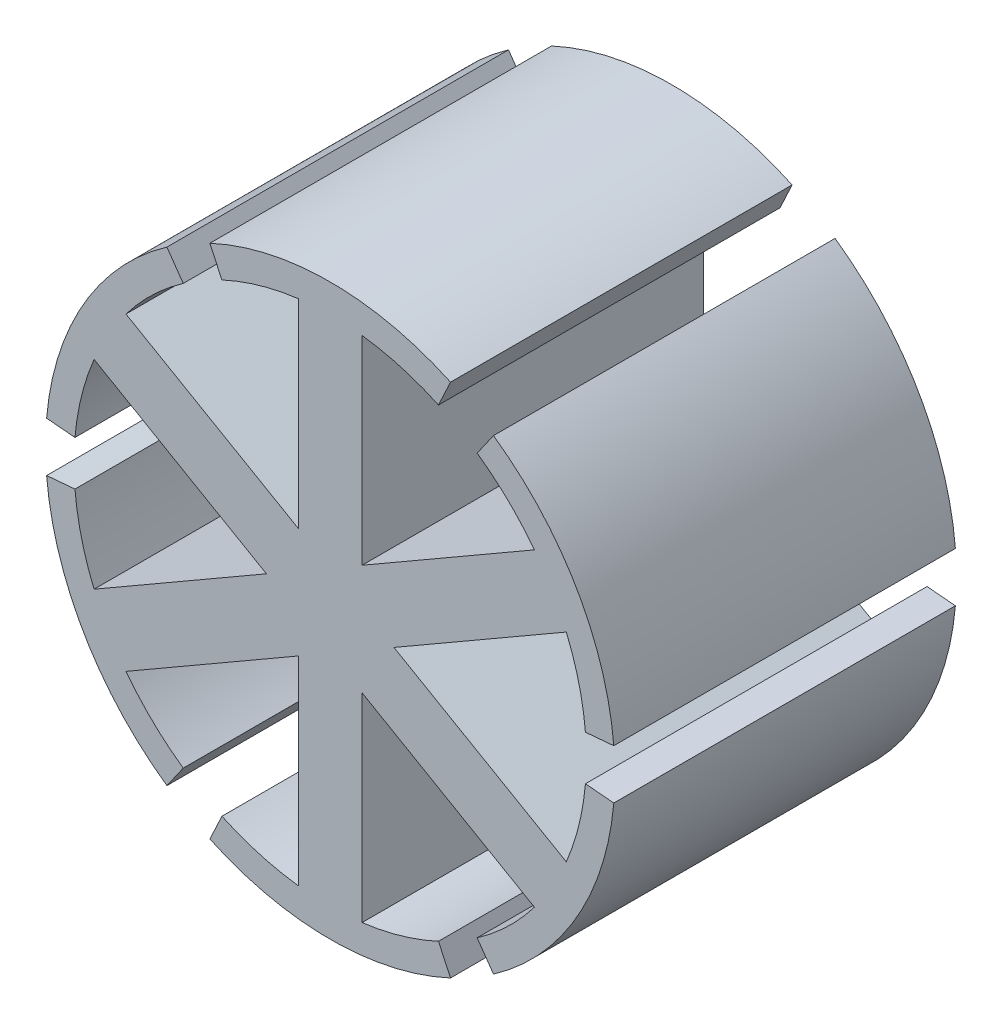
from build123d import *

# Parameters (mm, degrees)
BOSS_EXTRUDE1_DEPTH = 30


with BuildPart() as part:
    # Sketch2 → Boss-Extrude1 (new body)
    with BuildSketch(Plane.XY):
        with BuildLine():
            Line((2.8, 4.849742261), (17.934101996, 13.587420123))
            ThreePointArc((17.934101996, 13.587420123), (15.608801126, 16.205410436), (12.905469818, 18.430920997))
            Line((12.905469818, 18.430920997), (14.339410909, 20.478801107))
            ThreePointArc((14.339410909, 20.478801107), (21.650635095, 12.5), (24.904867452, 2.178893569))
            Line((24.904867452, 2.178893569), (22.414380707, 1.961004212))
            ThreePointArc((22.414380707, 1.961004212), (21.83869768, 5.41491308), (20.734101996, 8.737677861))
            Line((20.734101996, 8.737677861), (5.6, 0))
            Line((5.6, 0), (20.734101996, -8.737677861))
            ThreePointArc((20.734101996, -8.737677861), (21.83869768, -5.41491308), (22.414380707, -1.961004212))
            Line((22.414380707, -1.961004212), (24.904867452, -2.178893569))
            ThreePointArc((24.904867452, -2.178893569), (21.650635095, -12.5), (14.339410909, -20.478801107))
            Line((14.339410909, -20.478801107), (12.905469818, -18.430920997))
            ThreePointArc((12.905469818, -18.430920997), (15.608801126, -16.205410436), (17.934101996, -13.587420123))
            Line((17.934101996, -13.587420123), (2.8, -4.849742261))
            Line((2.8, -4.849742261), (2.8, -22.325097984))
            ThreePointArc((2.8, -22.325097984), (6.229896553, -21.620323516), (9.508910889, -20.391925208))
            Line((9.508910889, -20.391925208), (10.565456544, -22.657694676))
            ThreePointArc((10.565456544, -22.657694676), (0, -25), (-10.565456544, -22.657694676))
            Line((-10.565456544, -22.657694676), (-9.508910889, -20.391925208))
            ThreePointArc((-9.508910889, -20.391925208), (-6.229896553, -21.620323516), (-2.8, -22.325097984))
            Line((-2.8, -22.325097984), (-2.8, -4.849742261))
            Line((-2.8, -4.849742261), (-17.934101996, -13.587420123))
            ThreePointArc((-17.934101996, -13.587420123), (-15.608801126, -16.205410436), (-12.905469818, -18.430920997))
            Line((-12.905469818, -18.430920997), (-14.339410909, -20.478801107))
            ThreePointArc((-14.339410909, -20.478801107), (-21.650635095, -12.5), (-24.904867452, -2.178893569))
            Line((-24.904867452, -2.178893569), (-22.414380707, -1.961004212))
            ThreePointArc((-22.414380707, -1.961004212), (-21.83869768, -5.41491308), (-20.734101996, -8.737677861))
            Line((-20.734101996, -8.737677861), (-5.6, 0))
            Line((-5.6, 0), (-20.734101996, 8.737677861))
            ThreePointArc((-20.734101996, 8.737677861), (-21.83869768, 5.41491308), (-22.414380707, 1.961004212))
            Line((-22.414380707, 1.961004212), (-24.904867452, 2.178893569))
            ThreePointArc((-24.904867452, 2.178893569), (-21.650635095, 12.5), (-14.339410909, 20.478801107))
            Line((-14.339410909, 20.478801107), (-12.905469818, 18.430920997))
            ThreePointArc((-12.905469818, 18.430920997), (-15.608801126, 16.205410436), (-17.934101996, 13.587420123))
            Line((-17.934101996, 13.587420123), (-2.8, 4.849742261))
            Line((-2.8, 4.849742261), (-2.8, 22.325097984))
            ThreePointArc((-2.8, 22.325097984), (-6.229896553, 21.620323516), (-9.508910889, 20.391925208))
            Line((-9.508910889, 20.391925208), (-10.565456544, 22.657694676))
            ThreePointArc((-10.565456544, 22.657694676), (0, 25), (10.565456544, 22.657694676))
            Line((10.565456544, 22.657694676), (9.508910889, 20.391925208))
            ThreePointArc((9.508910889, 20.391925208), (6.229896553, 21.620323516), (2.8, 22.325097984))
            Line((2.8, 22.325097984), (2.8, 4.849742261))
        make_face()
    extrude(amount=BOSS_EXTRUDE1_DEPTH)


solid = part.part
